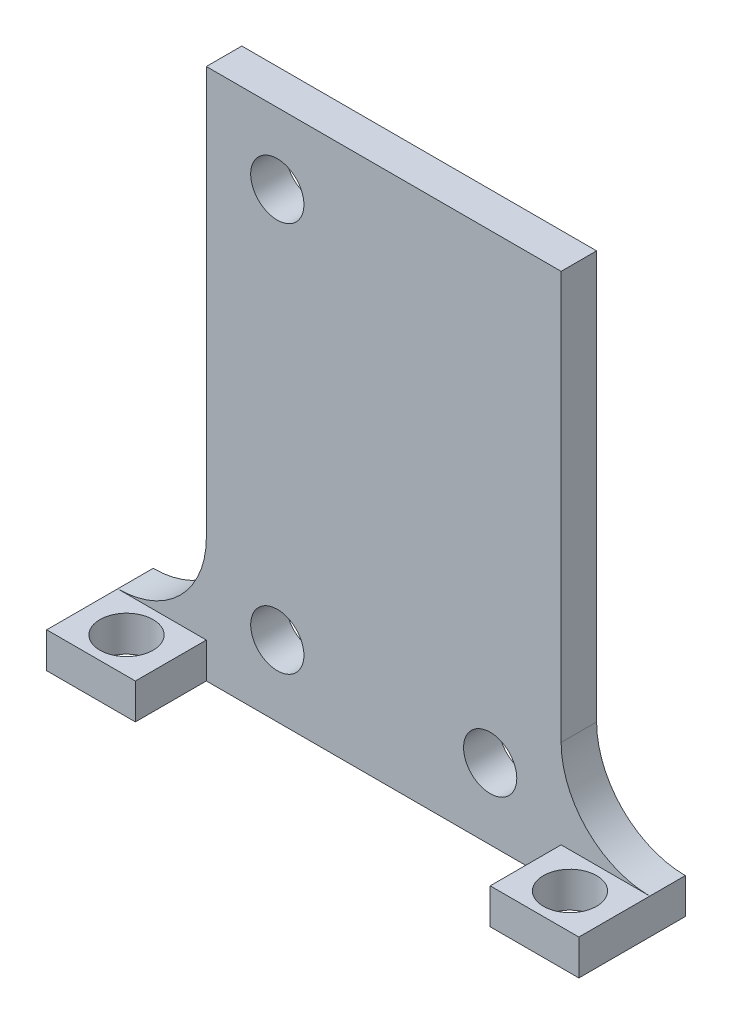
from build123d import *

# Parameters (mm, degrees)
SKETCH1_W           = 25.4
SKETCH1_H           = 38.1
SKETCH1_R           = 1.905
BOSS_EXTRUDE1_DEPTH = 1.27
SKETCH2_W           = 6.35
SKETCH2_H           = 7.62
SKETCH2_R           = 1.905
BOSS_EXTRUDE2_DEPTH = 2.54
FILLET1_R           = 6.35


with BuildPart() as part:
    # Sketch1 → Boss-Extrude1 (new, symmetric)
    with BuildSketch(Plane.XY):
        Rectangle(SKETCH1_W, SKETCH1_H)
        with Locations((-7.62, 13.97)):
            Circle(SKETCH1_R, mode=Mode.SUBTRACT)
        with Locations((-7.62, -13.97)):
            Circle(SKETCH1_R, mode=Mode.SUBTRACT)
        with Locations((7.62, -13.97)):
            Circle(SKETCH1_R, mode=Mode.SUBTRACT)
    extrude(amount=BOSS_EXTRUDE1_DEPTH, both=True)

    # Sketch2 → Boss-Extrude2 (add)
    with BuildSketch(Plane.XZ.offset(19.05)):
        with Locations((-15.875, 2.54)):
            Rectangle(SKETCH2_W, SKETCH2_H)
        with Locations(Location((-15.875, 3.81, 0), (0, 0, 270))):
            Circle(SKETCH2_R, mode=Mode.SUBTRACT)
    boss_extrude2 = extrude(amount=-BOSS_EXTRUDE2_DEPTH)

    # Mirror5: Boss-Extrude2 across plane
    add(boss_extrude2.mirror(Plane(origin=(0, 0, 0), x_dir=(0, 0, 1), z_dir=(1, 0, 0))))

    # Fillet1
    fillet1_edges = [part.edges().sort_by_distance(p)[0] for p in [
        (-12.7, -16.51, 0),
        (12.7, -16.51, 0),
    ]]
    fillet(fillet1_edges, radius=FILLET1_R - 0.0001)  # a hair under: the kernel refuses the full size


solid = part.part
